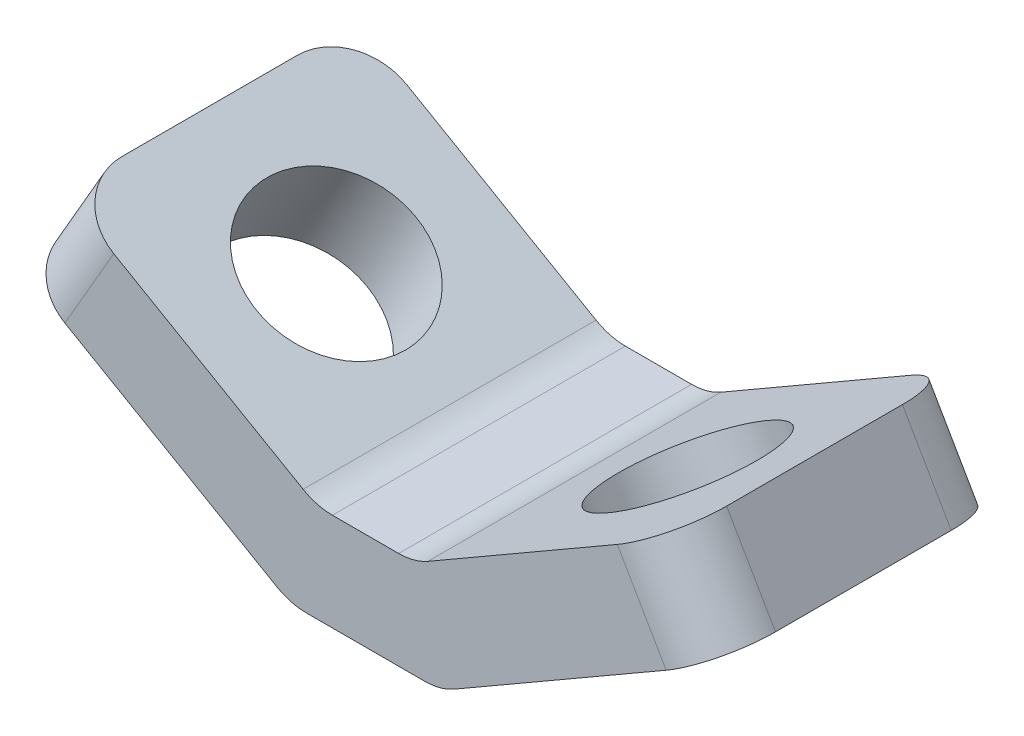
from build123d import *

# Parameters (mm, degrees)
EXTRUDE_1_DEPTH          = 7.5
CUT_EXTRUDE_1_DEPTH      = 27.249846584
CUT_EXTRUDE_1_DEPTH_BACK = 27.249846584
SKETCH_2_R               = 4.1
CUT_EXTRUDE_2_DEPTH      = 27.516200545
CUT_EXTRUDE_2_DEPTH_BACK = 27.516200545
SKETCH_3_R               = 4.1
FILLET_1_R               = 3


with BuildPart() as part:
    # ｽｹｯﾁ1 → ﾎﾞｽ - 押し出し1 (new, symmetric)
    with BuildSketch(Plane.XY):
        Polygon((0, 0), (-14.150635095, 8.169872981), (-11.650635095, 12.5), (1.339745962, 5), (6.339745962, 5), (19.330127019, 12.5), (21.830127019, 8.169872981), (7.679491924, 0), align=None)
    extrude(amount=EXTRUDE_1_DEPTH, both=True)

    # ｽｹｯﾁ2 → ｶｯﾄ - 押し出し1 (cut, two sides: drawn at the far end of the back side and taken through both)
    with BuildSketch(Plane(origin=(0, 0, 0), x_dir=(0, 0, 1), z_dir=(-0.5000000000000012, -0.866025403784438, 0)).offset(-CUT_EXTRUDE_1_DEPTH_BACK)):
        with Locations((0, 8.839745962)):
            Circle(SKETCH_2_R)
    extrude(amount=CUT_EXTRUDE_1_DEPTH + CUT_EXTRUDE_1_DEPTH_BACK, mode=Mode.SUBTRACT)

    # ｽｹｯﾁ3 → ｶｯﾄ - 押し出し2 (cut, two sides: drawn at the far end of the back side and taken through both)
    with BuildSketch(Plane(origin=(1.919872981, -3.325317547, 0), x_dir=(0, 0, -1), z_dir=(0.5000000000000013, -0.8660254037844379, 0)).offset(-CUT_EXTRUDE_2_DEPTH_BACK)):
        with Locations((0, 15.490381057)):
            Circle(SKETCH_3_R)
    extrude(amount=CUT_EXTRUDE_2_DEPTH + CUT_EXTRUDE_2_DEPTH_BACK, mode=Mode.SUBTRACT)

    # ﾌｨﾚｯﾄ1
    fillet_1_edges = [part.edges().sort_by_distance(p)[0] for p in [
        (20.580127019, 10.334936491, -7.5),
        (20.580127019, 10.334936491, 7.5),
        (-12.900635095, 10.334936491, -7.5),
        (-12.900635095, 10.334936491, 7.5),
        (7.679491924, 0, 0),
        (0, 0, 0),
        (6.339745962, 5, 0),
        (1.339745962, 5, 0),
    ]]
    fillet(fillet_1_edges, radius=FILLET_1_R)


solid = part.part
